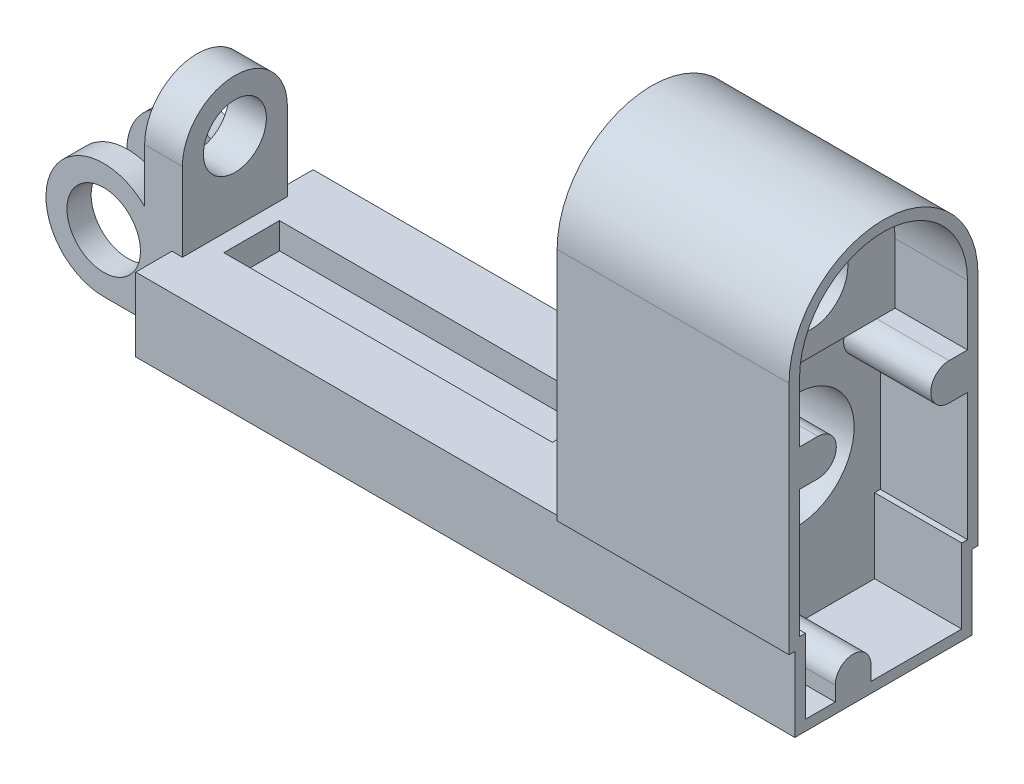
from build123d import *

# Parameters (mm, degrees)
BOSS_EXTRUDE18_DEPTH            = 24.1
CUT_EXTRUDE24_DEPTH             = 10.3
CUT_EXTRUDE25_DEPTH             = 8.9
BOSS_EXTRUDE7_DEPTH             = 9.3
CUT_EXTRUDE21_START             = -2
CUT_EXTRUDE21_DEPTH             = 2
BOSS_EXTRUDE2_REACH             = 48.304
SKETCH16_W                      = 40.7
SKETCH16_H                      = 7
BOSS_EXTRUDE2_DIRECTION_2_REACH = 48.304
BOSS_EXTRUDE3_REACH             = 58.743
SKETCH23_R                      = 3.5
BOSS_EXTRUDE3_DIRECTION_2_REACH = 58.743
SKETCH24_W                      = 12
SKETCH24_H                      = 5.4
SKETCH24_H_2                    = 3.45
CUT_EXTRUDE6_DEPTH              = 66.882774684
BOSS_EXTRUDE4_DEPTH             = 1
BOSS_EXTRUDE4_DEPTH_BACK        = 2.6
SKETCH28_R                      = 3
SKETCH33_W                      = 2.6
SKETCH33_H                      = 4
CUT_EXTRUDE10_DEPTH             = 5.4
CUT_EXTRUDE12_DEPTH             = 2.5
DELETEFACE7_START               = 23.1
DELETEFACE7_DEPTH               = 1
CUT_EXTRUDE29_START             = -1
SKETCH105_R                     = 1.7
CUT_EXTRUDE29_DEPTH             = 1
SKETCH106_W                     = 18
SKETCH106_H                     = 31.4
CUT_EXTRUDE30_DEPTH             = 2
CUT_EXTRUDE31_DEPTH             = 1.4


# Read off the part's stored shape, not the designer's step: DeleteFace7
with BuildPart() as part:
    # Sketch95 → Boss-Extrude18 (new body)
    with BuildSketch(Plane(origin=(0, 0, 0), x_dir=(0, 0, -1), z_dir=(1, 0, 0))):
        with BuildLine():
            Line((9, 29.5), (9, 7.1))
            Line((9, 7.1), (8.45, 7.1))
            Line((8.45, 7.1), (8.45, 0))
            Line((8.45, 0), (-8.45, 0))
            Line((-8.45, 0), (-8.45, 7.1))
            Line((-8.45, 7.1), (-9, 7.1))
            Line((-9, 7.1), (-9, 29.5))
            ThreePointArc((-9, 29.5), (0, 38.5), (9, 29.5))
        make_face()
    extrude(amount=BOSS_EXTRUDE18_DEPTH)

    # Sketch96 → Cut-Extrude24 (cut)
    with BuildSketch(Plane(origin=(24.1, 0, 0), x_dir=(0, 0, -1), z_dir=(1, 0, 0))):
        with BuildLine():
            Line((-7.45, 8.1), (-7.45, 1))
            Line((-7.45, 1), (7.45, 1))
            Line((7.45, 1), (7.45, 8.1))
            Line((7.45, 8.1), (8, 8.1))
            Line((8, 8.1), (8, 21.5))
            ThreePointArc((8, 21.5), (6.894427191, 23.288854382), (4.8, 23.1))
            ThreePointArc((4.8, 23.1), (0, 21.5), (-4.8, 23.1))
            ThreePointArc((-4.8, 23.1), (-6.894427191, 23.288854382), (-8, 21.5))
            Line((-8, 21.5), (-8, 8.1))
            Line((-8, 8.1), (-7.45, 8.1))
        make_face()
    extrude(amount=-CUT_EXTRUDE24_DEPTH, mode=Mode.SUBTRACT)

    # Sketch97 → Cut-Extrude25 (cut)
    with BuildSketch(Plane(origin=(24.1, 0, 0), x_dir=(0, 0, -1), z_dir=(1, 0, 0))):
        with BuildLine():
            Line((-8, 29.5), (-8, 21.5))
            Line((-8, 21.5), (8, 21.5))
            Line((8, 21.5), (8, 29.5))
            ThreePointArc((8, 29.5), (0, 37.5), (-8, 29.5))
        make_face()
    extrude(amount=-CUT_EXTRUDE25_DEPTH, mode=Mode.SUBTRACT)

    # Sketch11 → Cut-Revolve1 (revolve, cut)
    with BuildSketch(Plane.XY):
        Polygon((13.8, 14.5), (13.8, 9), (1.5, 9), (1.5, 10.25), (0, 10.25), (0, 14.5), align=None)
    revolve(axis=Axis((19.869277651, 14.5, 0), (-1, 0, 0)), mode=Mode.SUBTRACT)

    # Sketch12 → Cut-Revolve2 (revolve, cut)
    with BuildSketch(Plane.XY, mode=Mode.PRIVATE) as cut_revolve2_sk:
        Polygon((15.2, 29.5), (15.2, 26), (13.6, 26), (13.6, 22.25), (0, 22.25), (0, 29.5), align=None)
    revolve(cut_revolve2_sk.sketch.rotate(Axis((8.225974271, 29.5, 0), (1, 0, 0)), 270), axis=Axis((8.225974271, 29.5, 0), (1, 0, 0)), mode=Mode.SUBTRACT)

    # Sketch69 → Boss-Extrude7 (add)
    with BuildSketch(Plane(origin=(13.8, 0, 0), x_dir=(0, 0, -1), z_dir=(1, 0, 0))):
        with BuildLine():
            Line((8, 23.75), (8, 20.25))
            Line((8, 20.25), (6.25, 20.25))
            ThreePointArc((6.25, 20.25), (4.5, 22), (6.25, 23.75))
            Line((6.25, 23.75), (8, 23.75))
        make_face()
        with BuildLine():
            Line((-8, 23.75), (-8, 20.25))
            Line((-8, 20.25), (-6.25, 20.25))
            ThreePointArc((-6.25, 20.25), (-4.5, 22), (-6.25, 23.75))
            Line((-6.25, 23.75), (-8, 23.75))
        make_face()
        with BuildLine():
            Line((-4.6, 2.4), (-4.6, 1))
            Line((-4.6, 1), (-1.2, 1))
            Line((-1.2, 1), (-1.2, 2.4))
            ThreePointArc((-1.2, 2.4), (-2.9, 4.1), (-4.6, 2.4))
        make_face()
    extrude(amount=BOSS_EXTRUDE7_DEPTH)

    # Sketch80 → Cut-Extrude21 (cut)
    with BuildSketch(Plane(origin=(24.1, 0, 0), x_dir=(0, 0, -1), z_dir=(1, 0, 0)).offset(CUT_EXTRUDE21_START)):
        with BuildLine():
            Line((-7.45, 0), (-9, 0))
            Line((-9, 0), (-9, 8.1))
            Line((-9, 8.1), (-7.45, 8.1))
            Line((-7.45, 8.1), (-7.45, 2.4))
            Line((-7.45, 2.4), (-4.6, 2.4))
            ThreePointArc((-4.6, 2.4), (-2.9, 0.7), (-1.2, 2.4))
            Line((-1.2, 2.4), (7.45, 2.4))
            Line((7.45, 2.4), (7.45, 8.1))
            Line((7.45, 8.1), (9, 8.1))
            Line((9, 8.1), (9, 0))
            Line((9, 0), (7.45, 0))
            Line((7.45, 0), (-7.45, 0))
        make_face()
    extrude(amount=CUT_EXTRUDE21_DEPTH, mode=Mode.SUBTRACT)

    # Boss-Extrude2: up to this face of the body (flat: up to its plane)
    boss_extrude2_end = Plane(part.part.faces().sort_by_distance((11.05, 3.55, 8.45))[0])
    # Sketch16 → Boss-Extrude2 (add, up to the picked face)
    with BuildSketch(Plane.XY, mode=Mode.PRIVATE) as boss_extrude2_sk1:
        with Locations((-20.35, 3.5)):
            Rectangle(SKETCH16_W, SKETCH16_H)
    boss_extrude2_tool1 = split(extrude(boss_extrude2_sk1.sketch, amount=BOSS_EXTRUDE2_REACH, mode=Mode.PRIVATE), bisect_by=boss_extrude2_end, keep=Keep.BOTH, mode=Mode.PRIVATE)
    add(boss_extrude2_tool1.solids().sort_by(Axis((-20.35, 3.5, 0), (0, 0, 1)))[0])

    # Boss-Extrude2 direction 2: up to this face of the body (flat: up to its plane)
    boss_extrude2_direction_2_end = Plane(part.part.faces().sort_by_distance((11.05, 3.55, -8.45))[0])
    # Sketch16 → Boss-Extrude2 direction 2 (add, up to the picked face)
    with BuildSketch(Plane.XY, mode=Mode.PRIVATE) as boss_extrude2_direction_2_sk1:
        with Locations((-20.35, 3.5)):
            Rectangle(SKETCH16_W, SKETCH16_H)
    boss_extrude2_direction_2_tool1 = split(extrude(boss_extrude2_direction_2_sk1.sketch, amount=-BOSS_EXTRUDE2_DIRECTION_2_REACH, mode=Mode.PRIVATE), bisect_by=boss_extrude2_direction_2_end, keep=Keep.BOTH, mode=Mode.PRIVATE)
    add(boss_extrude2_direction_2_tool1.solids().sort_by(Axis((-20.35, 3.5, 0), (0, 0, -1)))[0])

    # Boss-Extrude3: up to this face of the body (flat: up to its plane)
    boss_extrude3_end = Plane(part.part.faces().sort_by_distance((-9.198206243, 3.517757633, 8.45))[0])
    # Sketch23 → Boss-Extrude3 (add, up to the picked face)
    with BuildSketch(Plane.XY, mode=Mode.PRIVATE) as boss_extrude3_sk1:
        with BuildLine():
            Line((-41.908497378, 7), (-40.7, 7))
            Line((-40.7, 7), (-40.7, 0))
            Line((-40.7, 0), (-47.2, 0))
            ThreePointArc((-47.2, 0), (-51.587482194, 8.81662479), (-41.908497378, 7))
        make_face()
        with Locations(Location((-47.2, 5.5, 0), (0, 0, 180))):
            Circle(SKETCH23_R, mode=Mode.SUBTRACT)
    boss_extrude3_tool1 = split(extrude(boss_extrude3_sk1.sketch, amount=BOSS_EXTRUDE3_REACH, mode=Mode.PRIVATE), bisect_by=boss_extrude3_end, keep=Keep.BOTH, mode=Mode.PRIVATE)
    add(boss_extrude3_tool1.solids().sort_by(Axis((-41.304249, 6.837212, 0), (0, 0, 1)))[0])

    # Boss-Extrude3 direction 2: up to this face of the body (flat: up to its plane)
    boss_extrude3_direction_2_end = Plane(part.part.faces().sort_by_distance((-9.198206243, 3.517757633, -8.45))[0])
    # Sketch23 → Boss-Extrude3 direction 2 (add, up to the picked face)
    with BuildSketch(Plane.XY, mode=Mode.PRIVATE) as boss_extrude3_direction_2_sk1:
        with BuildLine():
            Line((-41.908497378, 7), (-40.7, 7))
            Line((-40.7, 7), (-40.7, 0))
            Line((-40.7, 0), (-47.2, 0))
            ThreePointArc((-47.2, 0), (-51.587482194, 8.81662479), (-41.908497378, 7))
        make_face()
        with Locations(Location((-47.2, 5.5, 0), (0, 0, 180))):
            Circle(SKETCH23_R, mode=Mode.SUBTRACT)
    boss_extrude3_direction_2_tool1 = split(extrude(boss_extrude3_direction_2_sk1.sketch, amount=-BOSS_EXTRUDE3_DIRECTION_2_REACH, mode=Mode.PRIVATE), bisect_by=boss_extrude3_direction_2_end, keep=Keep.BOTH, mode=Mode.PRIVATE)
    add(boss_extrude3_direction_2_tool1.solids().sort_by(Axis((-41.304249, 6.837212, 0), (0, 0, -1)))[0])

    # Sketch24 → Cut-Extrude6 (cut, through all)
    with BuildSketch(Plane(origin=(0, 0, 0), x_dir=(1, 0, 0), z_dir=(0, 1, 0))):
        with Locations((-46.7, 0)):
            Rectangle(SKETCH24_W, SKETCH24_H)
        with Locations((-46.7, -6.725)):
            Rectangle(SKETCH24_W, SKETCH24_H_2)
        with Locations((-46.7, 6.725)):
            Rectangle(SKETCH24_W, SKETCH24_H_2)
    extrude(amount=CUT_EXTRUDE6_DEPTH, mode=Mode.SUBTRACT)

    # Sketch28 → Boss-Extrude4 (add, two sides: drawn at the far end of the back side and taken through both)
    with BuildSketch(Plane(origin=(-40.7, 0, 0), x_dir=(0, 0, -1), z_dir=(1, 0, 0)).offset(-BOSS_EXTRUDE4_DEPTH_BACK)):
        with BuildLine():
            Line((-5, 7), (5, 7))
            Line((5, 7), (5, 14.5))
            ThreePointArc((5, 14.5), (0, 19.5), (-5, 14.5))
            Line((-5, 14.5), (-5, 7))
        make_face()
        with Locations((0, 14.5)):
            Circle(SKETCH28_R, mode=Mode.SUBTRACT)
    extrude(amount=BOSS_EXTRUDE4_DEPTH + BOSS_EXTRUDE4_DEPTH_BACK)

    # Sketch33 → Cut-Extrude10 (cut)
    with BuildSketch(Plane.XY.offset(-2.7)):
        with Locations((-42, 7)):
            Rectangle(SKETCH33_W, SKETCH33_H)
    extrude(amount=CUT_EXTRUDE10_DEPTH, mode=Mode.SUBTRACT)

    # Sketch35 → Cut-Extrude12 (cut)
    with BuildSketch(Plane(origin=(0, 7, 0), x_dir=(1, 0, 0), z_dir=(0, 1, 0))):
        Polygon((-36.6, 2.65), (-38.1, 2.65), (-38.1, -2.65), (-36.6, -2.65), (-8.3, -2.65), (-6.8, -2.65), (-6.8, 2.65), (-8.3, 2.65), align=None)
    extrude(amount=-CUT_EXTRUDE12_DEPTH, mode=Mode.SUBTRACT)

    # DeleteFace7 outline → DeleteFace7 (cut)
    with BuildSketch(Plane.YZ.offset(DELETEFACE7_START)):
        with BuildLine():
            Line((1, 1.935634924), (1, 3.864365076))
            ThreePointArc((1, 3.864365076), (0.7, 2.9), (1, 1.935634924))
        make_face()
    extrude(amount=DELETEFACE7_DEPTH, mode=Mode.SUBTRACT)

    # Sketch105 → Cut-Extrude29 (cut)
    with BuildSketch(Plane(origin=(23.1, 0, 0), x_dir=(0, 0, -1), z_dir=(1, 0, 0)).offset(CUT_EXTRUDE29_START)):
        with Locations((-2.9, 2.4)):
            Circle(SKETCH105_R)
    extrude(amount=CUT_EXTRUDE29_DEPTH, mode=Mode.SUBTRACT)

    # Sketch106 → Cut-Extrude30 (cut)
    with BuildSketch(Plane(origin=(24.1, 0, 0), x_dir=(0, 0, -1), z_dir=(1, 0, 0))):
        with Locations((0, 22.8)):
            Rectangle(SKETCH106_W, SKETCH106_H)
    extrude(amount=-CUT_EXTRUDE30_DEPTH, mode=Mode.SUBTRACT)

    # Sketch107 → Cut-Extrude31 (cut)
    with BuildSketch(Plane(origin=(15.2, 0, 0), x_dir=(0, 0, -1), z_dir=(1, 0, 0))):
        with BuildLine():
            Line((-6.25, 23.75), (6.25, 23.75))
            ThreePointArc((6.25, 23.75), (5.583042256, 23.617920693), (5.016760303, 23.241619849))
            ThreePointArc((5.016760303, 23.241619849), (4.906085954, 23.174321373), (4.8, 23.1))
            ThreePointArc((4.8, 23.1), (0, 21.5), (-4.8, 23.1))
            ThreePointArc((-4.8, 23.1), (-4.906085954, 23.174321373), (-5.016760303, 23.241619849))
            ThreePointArc((-5.016760303, 23.241619849), (-5.583042256, 23.617920693), (-6.25, 23.75))
        make_face()
    extrude(amount=-CUT_EXTRUDE31_DEPTH, mode=Mode.SUBTRACT)


solid = part.part
